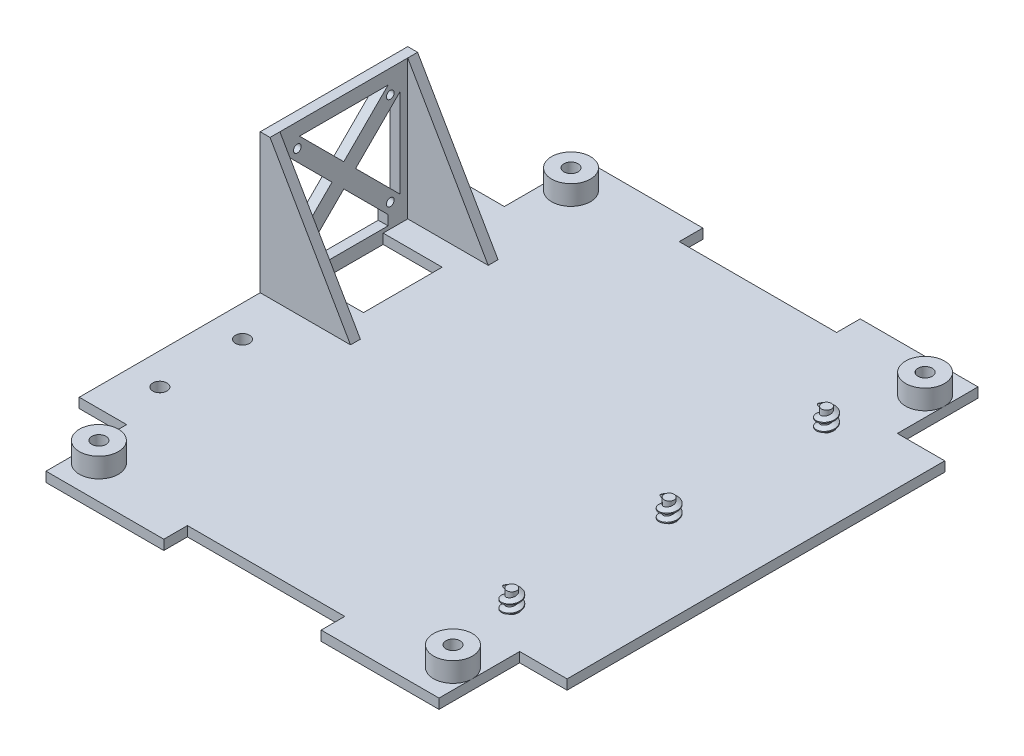
from build123d import *

# Parameters (mm, degrees)
SKETCH1_R           = 2.286
MAIN_BODY_DEPTH     = 3.175
SKETCH34_W          = 7.62
SKETCH34_H          = 50.8
BOSS_EXTRUDE3_DEPTH = 3.175
SKETCH3_R           = 1.5875
BOSS_EXTRUDE2_DEPTH = 6.35
THREAD1_PITCH       = 2.54
THREAD2_PITCH       = 2.54
THREAD3_PITCH       = 2.54
SKETCH35_R          = 6.28142
SKETCH35_R_2        = 2.286
BOSS_EXTRUDE4_DEPTH = 6.35
SKETCH37_W          = 3.175
SKETCH37_H          = 47.625
BOSS_EXTRUDE5_DEPTH = 45
BOSS_EXTRUDE6_DEPTH = 3.175
BOSS_EXTRUDE7_DEPTH = 3.175
SKETCH40_R          = 1.25
CUT_EXTRUDE3_DEPTH  = 3.175
CUT_EXTRUDE4_REACH  = 127.671
SKETCH41_W          = 19.05
SKETCH41_H          = 25.4
CUT_EXTRUDE6_REACH  = 188.25
SKETCH48_W          = 28.575
SKETCH48_H          = 3.175
SKETCH49_R          = 2.286
CUT_EXTRUDE7_DEPTH  = 126.670671432


with BuildPart() as part:
    # Sketch1 → Main Body (new body)
    with BuildSketch(Plane(origin=(0, 0, 0), x_dir=(1, 0, 0), z_dir=(0, 1, 0))):
        Polygon((-25.4, 86.995), (-63.43142, 86.995), (-63.43142, 60.96), (-78.74, 60.96), (-78.74, 25.4), (-71.12, 25.4), (-71.12, -25.4), (-78.74, -25.4), (-78.74, -60.96), (-63.43142, -60.96), (-63.43142, -86.995), (-25.4, -86.995), (-25.4, -79.375), (25.4, -79.375), (25.4, -86.995), (63.43142, -86.995), (63.43142, -60.96), (78.74, -60.96), (78.74, -25.4), (71.12, -25.4), (71.12, 25.4), (78.74, 25.4), (78.74, 60.96), (63.43142, 60.96), (63.43142, 86.995), (25.4, 86.995), (25.4, 79.375), (-25.4, 79.375), align=None)
        with Locations(Location((-57.15, 76.2, 0), (0, 0, 270))):
            Circle(SKETCH1_R, mode=Mode.SUBTRACT)
        with Locations(Location((57.15, 76.2, 0), (0, 0, 270))):
            Circle(SKETCH1_R, mode=Mode.SUBTRACT)
        with Locations(Location((57.15, -76.2, 0), (0, 0, 270))):
            Circle(SKETCH1_R, mode=Mode.SUBTRACT)
        with Locations(Location((-57.15, -76.2, 0), (0, 0, 270))):
            Circle(SKETCH1_R, mode=Mode.SUBTRACT)
    extrude(amount=MAIN_BODY_DEPTH)

    # Sketch34 → Boss-Extrude3 (add)
    with BuildSketch(Plane(origin=(0, 3.175, 0), x_dir=(1, 0, 0), z_dir=(0, 1, 0))):
        with Locations((-74.93, 0)):
            Rectangle(SKETCH34_W, SKETCH34_H)
        with Locations((74.93, 0)):
            Rectangle(SKETCH34_W, SKETCH34_H)
    extrude(amount=-BOSS_EXTRUDE3_DEPTH)

    # Sketch3 → Boss-Extrude2 (add)
    with BuildSketch(Plane(origin=(0, 3.175, 0), x_dir=(1, 0, 0), z_dir=(0, 1, 0))):
        with Locations(Location((50.73142, 50.8, 0), (0, 0, 270))):
            Circle(SKETCH3_R)
        with Locations(Location((50.73142, 0, 0), (0, 0, 270))):
            Circle(SKETCH3_R)
        with Locations(Location((50.73142, -50.8, 0), (0, 0, 270))):
            Circle(SKETCH3_R)
    extrude(amount=BOSS_EXTRUDE2_DEPTH)

    # Thread1: the profile of Thread Profile1 profile screwed along a right-hand helix of 2.5 turns, 10 arcs to a turn; built about Z, then put on its axis
    thread1_z = Axis((0, 0, 0), (0, 0, 1))
    thread1_corners = [(1.5872, 0, -0.000173205), (2.962315322, 0, 0.793749997), (2.962315322, 0, 1.111249997), (1.5872, 0, 1.905173198)]
    with BuildLine(mode=Mode.PRIVATE) as thread1_profile:
        Line(thread1_corners[0], thread1_corners[1])
        Line(thread1_corners[1], thread1_corners[2])
        Line(thread1_corners[2], thread1_corners[3])
        Line(thread1_corners[3], thread1_corners[0])
    thread1_cap = Face(thread1_profile.wire())
    thread1_turn_angles = [0, 18, 36, 54, 72, 90, 108, 126, 144, 162, 180, 198, 216, 234, 252, 270, 288, 306, 324, 342, 360]
    thread1_turn_weights = [1, 0.9510565162951535, 1, 0.9510565162951535, 1, 0.9510565162951535, 1, 0.9510565162951535, 1, 0.9510565162951535, 1, 0.9510565162951535, 1, 0.9510565162951535, 1, 0.9510565162951535, 1, 0.9510565162951535, 1, 0.9510565162951535, 1]
    thread1_turn_rails = [Edge.make_bspline([Vector(p[0], p[1], 0).rotate(thread1_z, thread1_turn_angles[k]) / thread1_turn_weights[k] + Vector(0, 0, p[2] + THREAD1_PITCH * thread1_turn_angles[k] / 360) for k in range(21)], [0, 0, 0, 1, 1, 2, 2, 3, 3, 4, 4, 5, 5, 6, 6, 7, 7, 8, 8, 9, 9, 10, 10, 10], 2, thread1_turn_weights) for p in thread1_corners]
    thread1_turn_sides = [Face.make_surface_from_curves(thread1_turn_rails[p[0]], thread1_turn_rails[p[1]]) for p in [(0, 1), (1, 2), (2, 3), (3, 0)]]
    thread1_last_angles = [720, 738, 756, 774, 792, 810, 828, 846, 864, 882, 900]
    thread1_last_weights = [1, 0.9510565162951535, 1, 0.9510565162951535, 1, 0.9510565162951535, 1, 0.9510565162951535, 1, 0.9510565162951542, 1]
    thread1_last_rails = [Edge.make_bspline([Vector(p[0], p[1], 0).rotate(thread1_z, thread1_last_angles[k]) / thread1_last_weights[k] + Vector(0, 0, p[2] + THREAD1_PITCH * thread1_last_angles[k] / 360) for k in range(11)], [0, 0, 0, 1, 1, 2, 2, 3, 3, 4, 4, 5, 5, 5], 2, thread1_last_weights) for p in thread1_corners]
    thread1_last_sides = [Face.make_surface_from_curves(thread1_last_rails[p[0]], thread1_last_rails[p[1]]) for p in [(0, 1), (1, 2), (2, 3), (3, 0)]]
    thread1 = Plane(origin=(50.73142, 9.525, -50.8), x_dir=(-1, 0, 0), z_dir=(0, -1, 0)) * Solid(Shell([*[p.moved(Location((0, 0, THREAD1_PITCH * i))) for i in range(2) for p in thread1_turn_sides], *thread1_last_sides, thread1_cap, thread1_cap.rotate(thread1_z, 900).moved(Location((0, 0, THREAD1_PITCH * 900 / 360)))]))
    add(thread1)

    # Thread2: the profile of Thread Profile3 profile screwed along a right-hand helix of 2.5 turns, 10 arcs to a turn; built about Z, then put on its axis
    thread2_z = Axis((0, 0, 0), (0, 0, 1))
    thread2_corners = [(1.5872, 0, -0.000173205), (2.962315322, 0, 0.793749997), (2.962315322, 0, 1.111249997), (1.5872, 0, 1.905173198)]
    with BuildLine(mode=Mode.PRIVATE) as thread2_profile:
        Line(thread2_corners[0], thread2_corners[1])
        Line(thread2_corners[1], thread2_corners[2])
        Line(thread2_corners[2], thread2_corners[3])
        Line(thread2_corners[3], thread2_corners[0])
    thread2_cap = Face(thread2_profile.wire())
    thread2_turn_angles = [0, 18, 36, 54, 72, 90, 108, 126, 144, 162, 180, 198, 216, 234, 252, 270, 288, 306, 324, 342, 360]
    thread2_turn_weights = [1, 0.9510565162951535, 1, 0.9510565162951535, 1, 0.9510565162951535, 1, 0.9510565162951535, 1, 0.9510565162951535, 1, 0.9510565162951535, 1, 0.9510565162951535, 1, 0.9510565162951535, 1, 0.9510565162951535, 1, 0.9510565162951535, 1]
    thread2_turn_rails = [Edge.make_bspline([Vector(p[0], p[1], 0).rotate(thread2_z, thread2_turn_angles[k]) / thread2_turn_weights[k] + Vector(0, 0, p[2] + THREAD2_PITCH * thread2_turn_angles[k] / 360) for k in range(21)], [0, 0, 0, 1, 1, 2, 2, 3, 3, 4, 4, 5, 5, 6, 6, 7, 7, 8, 8, 9, 9, 10, 10, 10], 2, thread2_turn_weights) for p in thread2_corners]
    thread2_turn_sides = [Face.make_surface_from_curves(thread2_turn_rails[p[0]], thread2_turn_rails[p[1]]) for p in [(0, 1), (1, 2), (2, 3), (3, 0)]]
    thread2_last_angles = [720, 738, 756, 774, 792, 810, 828, 846, 864, 882, 900]
    thread2_last_weights = [1, 0.9510565162951535, 1, 0.9510565162951535, 1, 0.9510565162951535, 1, 0.9510565162951535, 1, 0.9510565162951542, 1]
    thread2_last_rails = [Edge.make_bspline([Vector(p[0], p[1], 0).rotate(thread2_z, thread2_last_angles[k]) / thread2_last_weights[k] + Vector(0, 0, p[2] + THREAD2_PITCH * thread2_last_angles[k] / 360) for k in range(11)], [0, 0, 0, 1, 1, 2, 2, 3, 3, 4, 4, 5, 5, 5], 2, thread2_last_weights) for p in thread2_corners]
    thread2_last_sides = [Face.make_surface_from_curves(thread2_last_rails[p[0]], thread2_last_rails[p[1]]) for p in [(0, 1), (1, 2), (2, 3), (3, 0)]]
    thread2 = Plane(origin=(50.73142, 9.525, 0), x_dir=(-1, 0, 0), z_dir=(0, -1, 0)) * Solid(Shell([*[p.moved(Location((0, 0, THREAD2_PITCH * i))) for i in range(2) for p in thread2_turn_sides], *thread2_last_sides, thread2_cap, thread2_cap.rotate(thread2_z, 900).moved(Location((0, 0, THREAD2_PITCH * 900 / 360)))]))
    add(thread2)

    # Thread3: the profile of Thread Profile4 profile screwed along a right-hand helix of 2.5 turns, 10 arcs to a turn; built about Z, then put on its axis
    thread3_z = Axis((0, 0, 0), (0, 0, 1))
    thread3_corners = [(1.5872, 0, -0.000173205), (2.962315322, 0, 0.793749997), (2.962315322, 0, 1.111249997), (1.5872, 0, 1.905173198)]
    with BuildLine(mode=Mode.PRIVATE) as thread3_profile:
        Line(thread3_corners[0], thread3_corners[1])
        Line(thread3_corners[1], thread3_corners[2])
        Line(thread3_corners[2], thread3_corners[3])
        Line(thread3_corners[3], thread3_corners[0])
    thread3_cap = Face(thread3_profile.wire())
    thread3_turn_angles = [0, 18, 36, 54, 72, 90, 108, 126, 144, 162, 180, 198, 216, 234, 252, 270, 288, 306, 324, 342, 360]
    thread3_turn_weights = [1, 0.9510565162951535, 1, 0.9510565162951535, 1, 0.9510565162951535, 1, 0.9510565162951535, 1, 0.9510565162951535, 1, 0.9510565162951535, 1, 0.9510565162951535, 1, 0.9510565162951535, 1, 0.9510565162951535, 1, 0.9510565162951535, 1]
    thread3_turn_rails = [Edge.make_bspline([Vector(p[0], p[1], 0).rotate(thread3_z, thread3_turn_angles[k]) / thread3_turn_weights[k] + Vector(0, 0, p[2] + THREAD3_PITCH * thread3_turn_angles[k] / 360) for k in range(21)], [0, 0, 0, 1, 1, 2, 2, 3, 3, 4, 4, 5, 5, 6, 6, 7, 7, 8, 8, 9, 9, 10, 10, 10], 2, thread3_turn_weights) for p in thread3_corners]
    thread3_turn_sides = [Face.make_surface_from_curves(thread3_turn_rails[p[0]], thread3_turn_rails[p[1]]) for p in [(0, 1), (1, 2), (2, 3), (3, 0)]]
    thread3_last_angles = [720, 738, 756, 774, 792, 810, 828, 846, 864, 882, 900]
    thread3_last_weights = [1, 0.9510565162951535, 1, 0.9510565162951535, 1, 0.9510565162951535, 1, 0.9510565162951535, 1, 0.9510565162951542, 1]
    thread3_last_rails = [Edge.make_bspline([Vector(p[0], p[1], 0).rotate(thread3_z, thread3_last_angles[k]) / thread3_last_weights[k] + Vector(0, 0, p[2] + THREAD3_PITCH * thread3_last_angles[k] / 360) for k in range(11)], [0, 0, 0, 1, 1, 2, 2, 3, 3, 4, 4, 5, 5, 5], 2, thread3_last_weights) for p in thread3_corners]
    thread3_last_sides = [Face.make_surface_from_curves(thread3_last_rails[p[0]], thread3_last_rails[p[1]]) for p in [(0, 1), (1, 2), (2, 3), (3, 0)]]
    thread3 = Plane(origin=(50.73142, 9.525, 50.8), x_dir=(-1, 0, 0), z_dir=(0, -1, 0)) * Solid(Shell([*[p.moved(Location((0, 0, THREAD3_PITCH * i))) for i in range(2) for p in thread3_turn_sides], *thread3_last_sides, thread3_cap, thread3_cap.rotate(thread3_z, 900).moved(Location((0, 0, THREAD3_PITCH * 900 / 360)))]))
    add(thread3)

    # Sketch35 → Boss-Extrude4 (add)
    # profile 1 of 4: a face of its own
    with BuildSketch(Plane(origin=(0, 3.175, 0), x_dir=(1, 0, 0), z_dir=(0, 1, 0))):
        with Locations((57.15, 76.2)):
            Circle(SKETCH35_R)
        with Locations(Location((57.15, 76.2, 0), (0, 0, 270))):
            Circle(SKETCH35_R_2, mode=Mode.SUBTRACT)
    # profile 2 of 4: a face of its own
    with BuildSketch(Plane(origin=(0, 3.175, 0), x_dir=(1, 0, 0), z_dir=(0, 1, 0))):
        with Locations((57.15, -76.2)):
            Circle(SKETCH35_R)
        with Locations(Location((57.15, -76.2, 0), (0, 0, 270))):
            Circle(SKETCH35_R_2, mode=Mode.SUBTRACT)
    # profile 3 of 4: a face of its own
    with BuildSketch(Plane(origin=(0, 3.175, 0), x_dir=(1, 0, 0), z_dir=(0, 1, 0))):
        with Locations(Location((-57.15, -76.2, 0), (0, 0, 180))):
            Circle(SKETCH35_R)
        with Locations(Location((-57.15, -76.2, 0), (0, 0, 270))):
            Circle(SKETCH35_R_2, mode=Mode.SUBTRACT)
    # profile 4 of 4: a face of its own
    with BuildSketch(Plane(origin=(0, 3.175, 0), x_dir=(1, 0, 0), z_dir=(0, 1, 0))):
        with Locations(Location((-57.15, 76.2, 0), (0, 0, 180))):
            Circle(SKETCH35_R)
        with Locations(Location((-57.15, 76.2, 0), (0, 0, 270))):
            Circle(SKETCH35_R_2, mode=Mode.SUBTRACT)
    extrude(amount=BOSS_EXTRUDE4_DEPTH)

    # Sketch37 → Boss-Extrude5 (add)
    with BuildSketch(Plane(origin=(0, 3.175, 0), x_dir=(1, 0, 0), z_dir=(0, 1, 0))):
        with Locations((-77.1525, 21.2725)):
            Rectangle(SKETCH37_W, SKETCH37_H)
    extrude(amount=BOSS_EXTRUDE5_DEPTH)

    # Sketch38 → Boss-Extrude6 (add)
    with BuildSketch(Plane(origin=(0, 0, -45.085), x_dir=(-1, 0, 0), z_dir=(0, 0, -1))):
        Polygon((75.565, 48.175), (49.584237886, 3.175), (75.565, 3.175), align=None)
    extrude(amount=-BOSS_EXTRUDE6_DEPTH)

    # Sketch39 → Boss-Extrude7 (add)
    with BuildSketch(Plane.XY.offset(2.54)):
        Polygon((-49.584237886, 3.175), (-75.565, 3.175), (-75.565, 48.175), align=None)
    extrude(amount=-BOSS_EXTRUDE7_DEPTH)

    # Sketch40 → Cut-Extrude3 (cut)
    with BuildSketch(Plane.ZY.offset(78.74)):
        with Locations((-36.2725, 40.675)):
            Circle(SKETCH40_R)
        with Locations((-6.2725, 40.675)):
            Circle(SKETCH40_R)
        with Locations((-6.2725, 10.675)):
            Circle(SKETCH40_R)
        with Locations((-36.2725, 10.675)):
            Circle(SKETCH40_R)
        Polygon((-35.56, 43.7725), (-6.985, 43.7725), (-21.2725, 29.485), align=None)
        Polygon((-17.4625, 25.675), (-3.175, 39.9625), (-3.175, 11.3875), align=None)
        Polygon((-21.2725, 21.865), (-6.985, 7.5775), (-35.56, 7.5775), align=None)
        Polygon((-25.0825, 25.675), (-39.37, 11.3875), (-39.37, 39.9625), align=None)
    extrude(amount=-CUT_EXTRUDE3_DEPTH, mode=Mode.SUBTRACT)

    # Sketch41 → Cut-Extrude4 (cut, up to next)
    with BuildSketch(Plane(origin=(0, 3.175, 0), x_dir=(1, 0, 0), z_dir=(0, 1, 0)), mode=Mode.PRIVATE) as cut_extrude4_sk1:
        with Locations((-66.04, 21.2725)):
            Rectangle(SKETCH41_W, SKETCH41_H)
    cut_extrude4_tool1 = extrude(cut_extrude4_sk1.sketch, amount=-CUT_EXTRUDE4_REACH, mode=Mode.PRIVATE) & part.part
    add(cut_extrude4_tool1.solids().sort_by_distance((-66.04, 3.175, -21.2725))[0], mode=Mode.SUBTRACT)

    # Sketch48 → Cut-Extrude6 (cut, up to next)
    with BuildSketch(Plane.ZY.offset(78.74), mode=Mode.PRIVATE) as cut_extrude6_sk1:
        with Locations((-21.2725, 5.99)):
            Rectangle(SKETCH48_W, SKETCH48_H)
    cut_extrude6_tool1 = extrude(cut_extrude6_sk1.sketch, amount=-CUT_EXTRUDE6_REACH, mode=Mode.PRIVATE) & part.part
    add(cut_extrude6_tool1.solids().sort_by_distance((-78.74, 5.99, -21.2725))[0], mode=Mode.SUBTRACT)

    # Sketch49 → Cut-Extrude7 (cut, through all)
    with BuildSketch(Plane(origin=(0, 3.175, 0), x_dir=(1, 0, 0), z_dir=(0, 1, 0))):
        with Locations(Location((-68.58, -18.415, 0), (0, 0, 270))):
            Circle(SKETCH49_R)
        with Locations(Location((-68.58, -45.085, 0), (0, 0, 270))):
            Circle(SKETCH49_R)
    extrude(amount=-CUT_EXTRUDE7_DEPTH, mode=Mode.SUBTRACT)


solid = part.part
